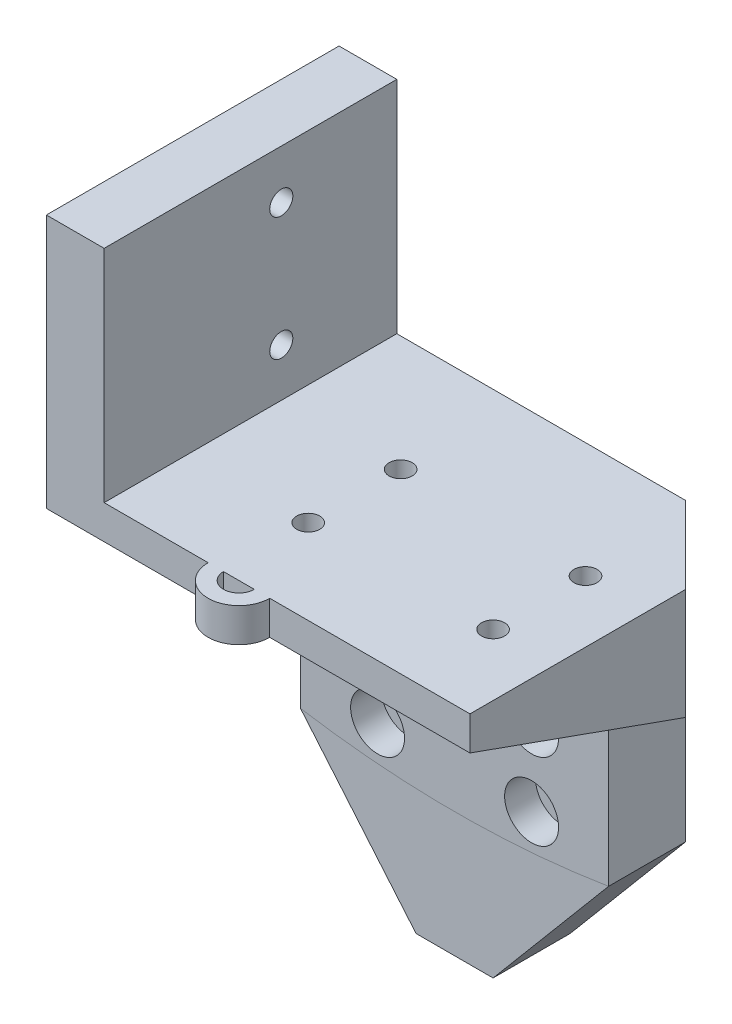
from build123d import *

# Parameters (mm, degrees)
BOSS_EXTRU_1_DEPTH      = 10
ENL_V_MAT_EXTRU_1_REACH = 128.984
ESQUISSE2_R             = 1.75
ESQUISSE4_R             = 3.5
ENL_V_MAT_EXTRU_2_DEPTH = 4
ESQUISSE5_W             = 50
ESQUISSE5_H             = 38
BOSS_EXTRU_2_DEPTH      = 14.4
ENL_V_MAT_EXTRU_3_REACH = 56.766
ESQUISSE6_R             = 1.5
ESQUISSE7_R             = 3
ENL_V_MAT_EXTRU_4_DEPTH = 9.4
CHANFREIN1_SIZE         = 10
CHANFREIN2_SIZE         = 28
CHANFREIN2_SIZE_2       = 10
BOSS_EXTRU_3_DEPTH      = 5
ESQUISSE9_W             = 38
ESQUISSE9_H             = 28.6
BOSS_EXTRU_4_DEPTH      = 2.5
CHANFREIN3_SIZE         = 5
ENL_V_MAT_EXTRU_5_REACH = 143.753
ESQUISSE10_R            = 1.5
ESQUISSE11_R            = 3
ENL_V_MAT_EXTRU_6_DEPTH = 2.5
BOSS_EXTRU_5_DEPTH      = 10
ESQUISSE14_R            = 2.75
ENL_V_MAT_EXTRU_7_DEPTH = 2
BOSS_EXTRU_6_DEPTH      = 4.4


# Some blends are built 0.0001 mm under size
with BuildPart() as part:
    # Esquisse1 → Boss.-Extru.1 (new body)
    with BuildSketch(Plane.XY):
        with BuildLine():
            Line((-20, -123.389626793), (-20, -99.4))
            Line((-20, -99.4), (20, -99.4))
            Line((20, -99.4), (20, -123.389626793))
            ThreePointArc((20, -123.389626793), (0, -125), (-20, -123.389626793))
        make_face()
    extrude(amount=BOSS_EXTRU_1_DEPTH)

    # Esquisse2 → Enlèv. mat.-Extru.1 (cut, up to next)
    with BuildSketch(Plane.XY.offset(10), mode=Mode.PRIVATE) as enl_v_mat_extru_1_sk1:
        with Locations((-10, -110)):
            Circle(ESQUISSE2_R)
    enl_v_mat_extru_1_tool1 = extrude(enl_v_mat_extru_1_sk1.sketch, amount=-ENL_V_MAT_EXTRU_1_REACH, mode=Mode.PRIVATE) & part.part
    # Esquisse2 → Enlèv. mat.-Extru.1 (cut, up to next)
    with BuildSketch(Plane.XY.offset(10), mode=Mode.PRIVATE) as enl_v_mat_extru_1_sk2:
        with Locations((-10, -120)):
            Circle(ESQUISSE2_R)
    enl_v_mat_extru_1_tool2 = extrude(enl_v_mat_extru_1_sk2.sketch, amount=-ENL_V_MAT_EXTRU_1_REACH, mode=Mode.PRIVATE) & part.part
    # Esquisse2 → Enlèv. mat.-Extru.1 (cut, up to next)
    with BuildSketch(Plane.XY.offset(10), mode=Mode.PRIVATE) as enl_v_mat_extru_1_sk3:
        with Locations((10, -110)):
            Circle(ESQUISSE2_R)
    enl_v_mat_extru_1_tool3 = extrude(enl_v_mat_extru_1_sk3.sketch, amount=-ENL_V_MAT_EXTRU_1_REACH, mode=Mode.PRIVATE) & part.part
    # Esquisse2 → Enlèv. mat.-Extru.1 (cut, up to next)
    with BuildSketch(Plane.XY.offset(10), mode=Mode.PRIVATE) as enl_v_mat_extru_1_sk4:
        with Locations((10, -120)):
            Circle(ESQUISSE2_R)
    enl_v_mat_extru_1_tool4 = extrude(enl_v_mat_extru_1_sk4.sketch, amount=-ENL_V_MAT_EXTRU_1_REACH, mode=Mode.PRIVATE) & part.part
    add(enl_v_mat_extru_1_tool1.solids().sort_by_distance((-10, -110, 10))[0], mode=Mode.SUBTRACT)
    add(enl_v_mat_extru_1_tool2.solids().sort_by_distance((-10, -120, 10))[0], mode=Mode.SUBTRACT)
    add(enl_v_mat_extru_1_tool3.solids().sort_by_distance((10, -110, 10))[0], mode=Mode.SUBTRACT)
    add(enl_v_mat_extru_1_tool4.solids().sort_by_distance((10, -120, 10))[0], mode=Mode.SUBTRACT)

    # Esquisse4 → Enlèv. mat.-Extru.2 (cut)
    with BuildSketch(Plane.XY.offset(10)):
        with Locations((-10, -110)):
            Circle(ESQUISSE4_R)
        with Locations((10, -110)):
            Circle(ESQUISSE4_R)
        with Locations((10, -120)):
            Circle(ESQUISSE4_R)
        with Locations((-10, -120)):
            Circle(ESQUISSE4_R)
    extrude(amount=-ENL_V_MAT_EXTRU_2_DEPTH, mode=Mode.SUBTRACT)

    # Esquisse5 → Boss.-Extru.2 (add)
    with BuildSketch(Plane(origin=(0, -99.4, 0), x_dir=(1, 0, 0), z_dir=(0, 1, 0))):
        with Locations((5, -19)):
            Rectangle(ESQUISSE5_W, ESQUISSE5_H)
    extrude(amount=BOSS_EXTRU_2_DEPTH)

    # Esquisse6 → Enlèv. mat.-Extru.3 (cut, up to next)
    with BuildSketch(Plane.XZ.offset(99.4), mode=Mode.PRIVATE) as enl_v_mat_extru_3_sk1:
        with Locations(Location((-2, 27, 0), (0, 0, 270))):
            Circle(ESQUISSE6_R)
    enl_v_mat_extru_3_tool1 = extrude(enl_v_mat_extru_3_sk1.sketch, amount=-ENL_V_MAT_EXTRU_3_REACH, mode=Mode.PRIVATE) & part.part
    # Esquisse6 → Enlèv. mat.-Extru.3 (cut, up to next)
    with BuildSketch(Plane.XZ.offset(99.4), mode=Mode.PRIVATE) as enl_v_mat_extru_3_sk2:
        with Locations(Location((22, 27, 0), (0, 0, 270))):
            Circle(ESQUISSE6_R)
    enl_v_mat_extru_3_tool2 = extrude(enl_v_mat_extru_3_sk2.sketch, amount=-ENL_V_MAT_EXTRU_3_REACH, mode=Mode.PRIVATE) & part.part
    # Esquisse6 → Enlèv. mat.-Extru.3 (cut, up to next)
    with BuildSketch(Plane.XZ.offset(99.4), mode=Mode.PRIVATE) as enl_v_mat_extru_3_sk3:
        with Locations(Location((-2, 15, 0), (0, 0, 270))):
            Circle(ESQUISSE6_R)
    enl_v_mat_extru_3_tool3 = extrude(enl_v_mat_extru_3_sk3.sketch, amount=-ENL_V_MAT_EXTRU_3_REACH, mode=Mode.PRIVATE) & part.part
    # Esquisse6 → Enlèv. mat.-Extru.3 (cut, up to next)
    with BuildSketch(Plane.XZ.offset(99.4), mode=Mode.PRIVATE) as enl_v_mat_extru_3_sk4:
        with Locations(Location((22, 15, 0), (0, 0, 270))):
            Circle(ESQUISSE6_R)
    enl_v_mat_extru_3_tool4 = extrude(enl_v_mat_extru_3_sk4.sketch, amount=-ENL_V_MAT_EXTRU_3_REACH, mode=Mode.PRIVATE) & part.part
    add(enl_v_mat_extru_3_tool1.solids().sort_by_distance((-2, -99.4, 27))[0], mode=Mode.SUBTRACT)
    add(enl_v_mat_extru_3_tool2.solids().sort_by_distance((22, -99.4, 27))[0], mode=Mode.SUBTRACT)
    add(enl_v_mat_extru_3_tool3.solids().sort_by_distance((-2, -99.4, 15))[0], mode=Mode.SUBTRACT)
    add(enl_v_mat_extru_3_tool4.solids().sort_by_distance((22, -99.4, 15))[0], mode=Mode.SUBTRACT)

    # Esquisse7 → Enlèv. mat.-Extru.4 (cut)
    with BuildSketch(Plane.XZ.offset(99.4)):
        with Locations(Location((-2, 27, 0), (0, 0, 270))):
            Circle(ESQUISSE7_R)
        with Locations(Location((22, 27, 0), (0, 0, 270))):
            Circle(ESQUISSE7_R)
        with Locations(Location((22, 15, 0), (0, 0, 270))):
            Circle(ESQUISSE7_R)
        with Locations(Location((-2, 15, 0), (0, 0, 270))):
            Circle(ESQUISSE7_R)
    extrude(amount=-ENL_V_MAT_EXTRU_4_DEPTH, mode=Mode.SUBTRACT)

    # Chanfrein1
    chanfrein1_edges = [part.edges().sort_by_distance(p)[0] for p in [
        (30, -92.2, 0),
    ]]
    chamfer(chanfrein1_edges, length=CHANFREIN1_SIZE)

    # Chanfrein2
    # the kernel refuses this chamfer: 28, 10 mm, written as the material it takes off along each edge
    with BuildSketch(Plane(origin=(102.642981969, -99.4, 38), x_dir=(0, -0.01296397650632004, -0.9999159641255577), z_dir=(-1, 0, 0))) as chanfrein2_piece_1:
        Polygon((CHANFREIN2_SIZE * 0.999915964126, -CHANFREIN2_SIZE * 0.0129639765063), (-CHANFREIN2_SIZE_2 * 0.0129639765063, -CHANFREIN2_SIZE_2 * 0.999915964126), (0, 0), align=None)
    extrude(amount=195.285963938, mode=Mode.SUBTRACT)

    # Esquisse8 → Boss.-Extru.3 (add)
    with BuildSketch(Plane.ZY.offset(20)):
        Polygon((10, -99.4), (0, -99.4), (0, -56.4), (38, -56.4), (38, -89.4), align=None)
    extrude(amount=BOSS_EXTRU_3_DEPTH)

    # Esquisse9 → Boss.-Extru.4 (add)
    with BuildSketch(Plane(origin=(-20, 0, 0), x_dir=(0, 0, -1), z_dir=(1, 0, 0))):
        with Locations((-19, -70.7)):
            Rectangle(ESQUISSE9_W, ESQUISSE9_H)
    extrude(amount=BOSS_EXTRU_4_DEPTH)

    # Chanfrein3
    chanfrein3_edges = [part.edges().sort_by_distance(p)[0] for p in [
        (-20, -99.4, 5),
    ]]
    chamfer(chanfrein3_edges, length=CHANFREIN3_SIZE - 0.0001)  # a hair under: the kernel refuses the full size

    # Esquisse10 → Enlèv. mat.-Extru.5 (cut, up to next)
    with BuildSketch(Plane.ZY.offset(25), mode=Mode.PRIVATE) as enl_v_mat_extru_5_sk1:
        with Locations(Location((15, -62.75, 0), (0, 0, 270))):
            Circle(ESQUISSE10_R)
    enl_v_mat_extru_5_tool1 = extrude(enl_v_mat_extru_5_sk1.sketch, amount=-ENL_V_MAT_EXTRU_5_REACH, mode=Mode.PRIVATE) & part.part
    # Esquisse10 → Enlèv. mat.-Extru.5 (cut, up to next)
    with BuildSketch(Plane.ZY.offset(25), mode=Mode.PRIVATE) as enl_v_mat_extru_5_sk2:
        with Locations(Location((15, -78.75, 0), (0, 0, 270))):
            Circle(ESQUISSE10_R)
    enl_v_mat_extru_5_tool2 = extrude(enl_v_mat_extru_5_sk2.sketch, amount=-ENL_V_MAT_EXTRU_5_REACH, mode=Mode.PRIVATE) & part.part
    add(enl_v_mat_extru_5_tool1.solids().sort_by_distance((-25, -62.75, 15))[0], mode=Mode.SUBTRACT)
    add(enl_v_mat_extru_5_tool2.solids().sort_by_distance((-25, -78.75, 15))[0], mode=Mode.SUBTRACT)

    # Esquisse11 → Enlèv. mat.-Extru.6 (cut)
    with BuildSketch(Plane.ZY.offset(25)):
        with Locations(Location((15, -62.75, 0), (0, 0, 270))):
            Circle(ESQUISSE11_R)
        with Locations(Location((15, -78.75, 0), (0, 0, 270))):
            Circle(ESQUISSE11_R)
    extrude(amount=-ENL_V_MAT_EXTRU_6_DEPTH, mode=Mode.SUBTRACT)

    # Esquisse15 → Boss.-Extru.6 (add)
    with BuildSketch(Plane(origin=(0, -85, 0), x_dir=(1, 0, 0), z_dir=(0, 1, 0))):
        with BuildLine():
            Line((4, -38), (2, -38))
            ThreePointArc((2, -38), (0, -40), (-2, -38))
            Line((-2, -38), (-4, -38))
            ThreePointArc((-4, -38), (0, -42), (4, -38))
        make_face()
    extrude(amount=-BOSS_EXTRU_6_DEPTH)


with BuildPart() as body_2:
    # Esquisse12 → Boss.-Extru.5 (new body)
    with BuildSketch(Plane.XY.offset(10)):
        with BuildLine():
            Line((-5, -141.2), (5, -141.2))
            Line((5, -141.2), (20, -123.389626793))
            ThreePointArc((20, -123.389626793), (0, -125), (-20, -123.389626793))
            Line((-20, -123.389626793), (-5, -141.2))
        make_face()
    extrude(amount=-BOSS_EXTRU_5_DEPTH)

    # Esquisse14 → Enlèv. mat.-Extru.7 (cut)
    with BuildSketch(Plane.XZ.offset(141.2)):
        with Locations(Location((0, 5, 0), (0, 0, 270))):
            Circle(ESQUISSE14_R)
    extrude(amount=-ENL_V_MAT_EXTRU_7_DEPTH, mode=Mode.SUBTRACT)


solid = Compound([part.part, body_2.part])
